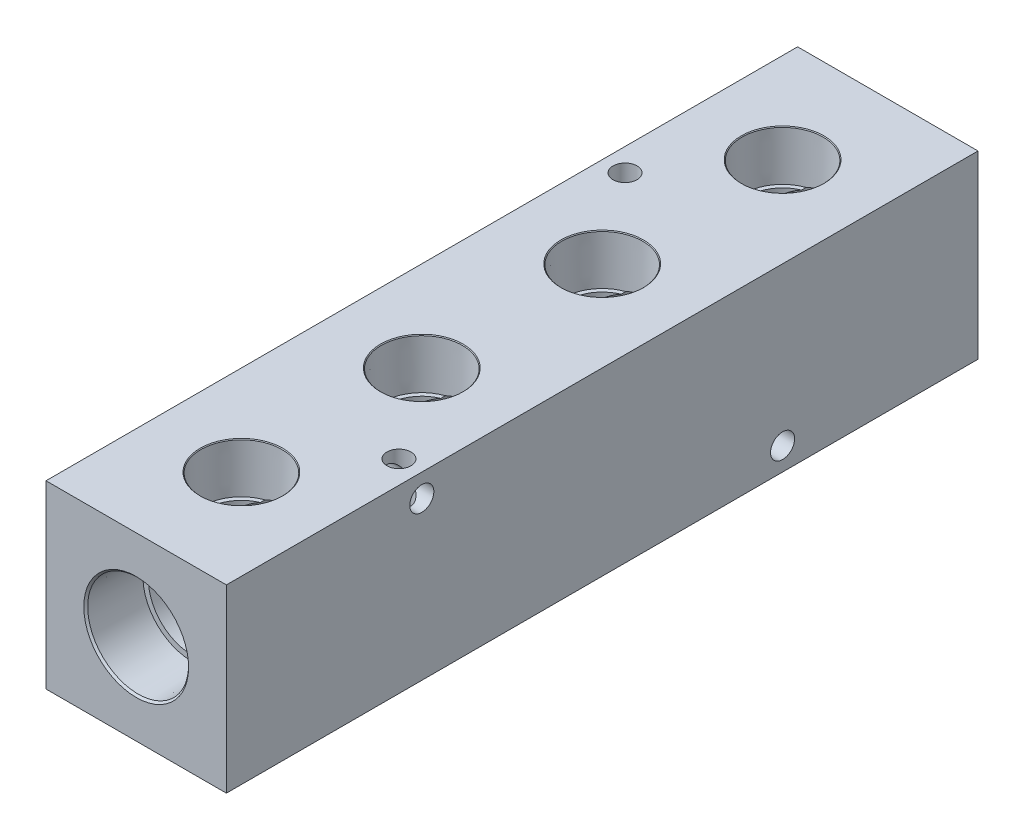
from build123d import *

# Parameters (mm, degrees)
SKETCH1_W                    = 38.1
SKETCH1_H                    = 38.1
BOSS_EXTRUDE1_DEPTH          = 79.375
SKETCH3_R                    = 8.5725
CUT_EXTRUDE1_DEPTH           = 10.35812
CUT_EXTRUDE1_DRAFT           = -1.783333333
LPATTERN1_COUNT              = 4
LPATTERN1_PITCH              = 38.1
LPATTERN1_COPY_1_SKETCH_R    = 8.5725
LPATTERN1_COPY_1_DEPTH       = 10.35812
LPATTERN1_COPY_1_DRAFT       = -1.783333333
LPATTERN1_COPY_2_SKETCH_R    = 8.5725
LPATTERN1_COPY_2_DEPTH       = 10.35812
LPATTERN1_COPY_2_DRAFT       = -1.783333333
LPATTERN1_COPY_3_SKETCH_R    = 8.5725
LPATTERN1_COPY_3_DEPTH       = 10.35812
LPATTERN1_COPY_3_DRAFT       = -1.783333333
SKETCH8_R                    = 10.668
CUT_EXTRUDE3_DEPTH           = 11.721742741
CUT_EXTRUDE3_DRAFT           = -1.783333333
SKETCH13_R                   = 11.064875
CUT_EXTRUDE6_DEPTH           = 2.54
CUT_EXTRUDE6_TAPER           = 45
CUT_EXTRUDE6_OTHER_WAY_DEPTH = 10.16
CUT_EXTRUDE6_OTHER_WAY_TAPER = 45
CIRPATTERN2_COUNT            = 2
CIRPATTERN2_COPY_1_SKETCH_R  = 10.668
CIRPATTERN2_COPY_1_DEPTH     = 11.721742741
CIRPATTERN2_COPY_1_DRAFT     = -1.783333333
SKETCH12_R                   = 2.54
CUT_EXTRUDE5_DEPTH           = 91.082757178
CIRPATTERN3_COUNT            = 2
CIRPATTERN3_ANGLE            = 90


# Read off the part's stored shape, not the designer's step: Cut-Extrude2
with BuildPart() as part:
    # Sketch1 → Boss-Extrude1 (new, symmetric)
    with BuildSketch(Plane.XY):
        Rectangle(SKETCH1_W, SKETCH1_H)
    extrude(amount=BOSS_EXTRUDE1_DEPTH, both=True)

    # Sketch2 → Cut-Revolve1 (revolve, cut)
    with BuildSketch(Plane(origin=(0, 0, 0), x_dir=(0, 0, -1), z_dir=(1, 0, 0)), mode=Mode.PRIVATE) as cut_revolve1_sk:
        Polygon((57.15, 19.05), (57.15, -4.411631326), (64.4921875, 0), (64.4921875, 19.05), align=None)
    cut_revolve1 = revolve(cut_revolve1_sk.sketch.rotate(Axis((0, 26.3921875, -57.15), (0, -1, 0)), 180), axis=Axis((0, 26.3921875, -57.15), (0, -1, 0)), mode=Mode.SUBTRACT)


with BuildPart() as cut_extrude1_tool:
    # Sketch3 → Cut-Extrude1 (with draft: the straight prism first)
    with BuildSketch(Plane(origin=(0, 19.05, 0), x_dir=(1, 0, 0), z_dir=(0, 1, 0))):
        with Locations((0, 57.15)):
            Circle(SKETCH3_R)
    extrude(amount=-CUT_EXTRUDE1_DEPTH)
    # Cut-Extrude1: the draft: its side faces are tilted about the plane it starts from
    cut_extrude1_sides = [cut_extrude1_tool.faces().sort_by_distance(p)[0] for p in [
        (-8.5725, 13.87094, -57.15),
    ]]
    draft(cut_extrude1_sides, Plane(origin=(0, 19.05, 0), x_dir=(1, 0, 0), z_dir=(0, 1, 0)), CUT_EXTRUDE1_DRAFT)


with BuildPart() as part_1:
    add(part.part)

    # Cut-Extrude1: cut by cut_extrude1_tool
    add(cut_extrude1_tool.part, mode=Mode.SUBTRACT)

    # Cut-Extrude2 outline → Cut-Extrude2 (revolve, cut)
    with BuildSketch(Plane.XY.offset(-57.15)):
        Polygon((8.567591048, 19.05), (8.567591048, 18.892333789), (8.725257259, 19.05), align=None)
    cut_extrude2 = revolve(axis=Axis((0, 0, -57.15), (0, 1, 0)), mode=Mode.SUBTRACT)

    # LPattern1: Cut-Revolve1, Cut-Extrude2 ×4
    with Locations(*[(0, 0, i * LPATTERN1_PITCH) for i in range(1, LPATTERN1_COUNT)]):
        add(cut_revolve1, mode=Mode.SUBTRACT)
        add(cut_extrude2, mode=Mode.SUBTRACT)


with BuildPart() as lpattern1_copy_1_tool:
    # LPattern1 copy 1 sketch → LPattern1 copy 1 (with draft: the straight prism first)
    with BuildSketch(Plane(origin=(0, 19.05, 38.1), x_dir=(1, 0, 0), z_dir=(0, 1, 0))):
        with Locations((0, 57.15)):
            Circle(LPATTERN1_COPY_1_SKETCH_R)
    extrude(amount=-LPATTERN1_COPY_1_DEPTH)
    # LPattern1 copy 1: the draft: its side faces are tilted about the plane it starts from
    lpattern1_copy_1_sides = [lpattern1_copy_1_tool.faces().sort_by_distance(p)[0] for p in [
        (-8.5725, 13.87094, -19.05),
    ]]
    draft(lpattern1_copy_1_sides, Plane(origin=(0, 19.05, 38.1), x_dir=(1, 0, 0), z_dir=(0, 1, 0)), LPATTERN1_COPY_1_DRAFT)


with BuildPart() as part_2:
    add(part_1.part)

    # LPattern1 copy 1: cut by lpattern1_copy_1_tool
    add(lpattern1_copy_1_tool.part, mode=Mode.SUBTRACT)


with BuildPart() as lpattern1_copy_2_tool:
    # LPattern1 copy 2 sketch → LPattern1 copy 2 (with draft: the straight prism first)
    with BuildSketch(Plane(origin=(0, 19.05, 76.2), x_dir=(1, 0, 0), z_dir=(0, 1, 0))):
        with Locations((0, 57.15)):
            Circle(LPATTERN1_COPY_2_SKETCH_R)
    extrude(amount=-LPATTERN1_COPY_2_DEPTH)
    # LPattern1 copy 2: the draft: its side faces are tilted about the plane it starts from
    lpattern1_copy_2_sides = [lpattern1_copy_2_tool.faces().sort_by_distance(p)[0] for p in [
        (-8.5725, 13.87094, 19.05),
    ]]
    draft(lpattern1_copy_2_sides, Plane(origin=(0, 19.05, 76.2), x_dir=(1, 0, 0), z_dir=(0, 1, 0)), LPATTERN1_COPY_2_DRAFT)


with BuildPart() as part_3:
    add(part_2.part)

    # LPattern1 copy 2: cut by lpattern1_copy_2_tool
    add(lpattern1_copy_2_tool.part, mode=Mode.SUBTRACT)


with BuildPart() as lpattern1_copy_3_tool:
    # LPattern1 copy 3 sketch → LPattern1 copy 3 (with draft: the straight prism first)
    with BuildSketch(Plane(origin=(0, 19.05, 114.3), x_dir=(1, 0, 0), z_dir=(0, 1, 0))):
        with Locations((0, 57.15)):
            Circle(LPATTERN1_COPY_3_SKETCH_R)
    extrude(amount=-LPATTERN1_COPY_3_DEPTH)
    # LPattern1 copy 3: the draft: its side faces are tilted about the plane it starts from
    lpattern1_copy_3_sides = [lpattern1_copy_3_tool.faces().sort_by_distance(p)[0] for p in [
        (-8.5725, 13.87094, 57.15),
    ]]
    draft(lpattern1_copy_3_sides, Plane(origin=(0, 19.05, 114.3), x_dir=(1, 0, 0), z_dir=(0, 1, 0)), LPATTERN1_COPY_3_DRAFT)


with BuildPart() as part_4:
    add(part_3.part)

    # LPattern1 copy 3: cut by lpattern1_copy_3_tool
    add(lpattern1_copy_3_tool.part, mode=Mode.SUBTRACT)

    # Sketch7 → Cut-Revolve2 (revolve, cut)
    with BuildSketch(Plane(origin=(0, 0, 0), x_dir=(0, 0, -1), z_dir=(1, 0, 0)), mode=Mode.PRIVATE) as cut_revolve2_sk:
        Polygon((-79.375, 0), (5.484730838, 0), (0, 9.128125), (-79.375, 9.128125), align=None)
    cut_revolve2 = revolve(cut_revolve2_sk.sketch.rotate(Axis((0, 0, 88.503125), (0, 0, -1)), 90), axis=Axis((0, 0, 88.503125), (0, 0, -1)), mode=Mode.SUBTRACT)


with BuildPart() as cut_extrude3_tool:
    # Sketch8 → Cut-Extrude3 (with draft: the straight prism first)
    with BuildSketch(Plane.XY.offset(79.375)):
        Circle(SKETCH8_R)
    extrude(amount=-CUT_EXTRUDE3_DEPTH)
    # Cut-Extrude3: the draft: its side faces are tilted about the plane it starts from
    cut_extrude3_sides = [cut_extrude3_tool.faces().sort_by_distance(p)[0] for p in [
        (-10.668, 0, 73.514128629),
    ]]
    draft(cut_extrude3_sides, Plane.XY.offset(79.375), CUT_EXTRUDE3_DRAFT)


with BuildPart() as part_5:
    add(part_4.part)

    # Cut-Extrude3: cut by cut_extrude3_tool
    add(cut_extrude3_tool.part, mode=Mode.SUBTRACT)

    # Sketch13 → Cut-Extrude6 (cut)
    with BuildSketch(Plane.XY.offset(79.375)):
        Circle(SKETCH13_R)
    cut_extrude6 = extrude(amount=-CUT_EXTRUDE6_DEPTH, taper=CUT_EXTRUDE6_TAPER, mode=Mode.SUBTRACT)

    # Sketch13 → Cut-Extrude6 other way (cut)
    with BuildSketch(Plane.XY.offset(79.375)):
        Circle(SKETCH13_R)
    extrude(amount=CUT_EXTRUDE6_OTHER_WAY_DEPTH, taper=CUT_EXTRUDE6_OTHER_WAY_TAPER, mode=Mode.SUBTRACT)

    # CirPattern2: Cut-Revolve2, Cut-Extrude6 ×2 about axis
    cirpattern2_axis = Axis((0, 21.367211937, 0), (0, -1, 0))
    add([cut_revolve2.rotate(cirpattern2_axis, i * 360 / CIRPATTERN2_COUNT) for i in range(1, CIRPATTERN2_COUNT)], mode=Mode.SUBTRACT)
    add([cut_extrude6.rotate(cirpattern2_axis, i * 360 / CIRPATTERN2_COUNT) for i in range(1, CIRPATTERN2_COUNT)], mode=Mode.SUBTRACT)


with BuildPart() as cirpattern2_copy_1_tool:
    # CirPattern2 copy 1 sketch → CirPattern2 copy 1 (with draft: the straight prism first)
    with BuildSketch(Plane(origin=(0, 0, -79.375), x_dir=(-1, 0, 0), z_dir=(0, 0, -1))):
        Circle(CIRPATTERN2_COPY_1_SKETCH_R)
    extrude(amount=-CIRPATTERN2_COPY_1_DEPTH)
    # CirPattern2 copy 1: the draft: its side faces are tilted about the plane it starts from
    cirpattern2_copy_1_sides = [cirpattern2_copy_1_tool.faces().sort_by_distance(p)[0] for p in [
        (10.668, 0, -73.514128629),
    ]]
    draft(cirpattern2_copy_1_sides, Plane(origin=(0, 0, -79.375), x_dir=(-1, 0, 0), z_dir=(0, 0, -1)), CIRPATTERN2_COPY_1_DRAFT)


with BuildPart() as part_6:
    add(part_5.part)

    # CirPattern2 copy 1: cut by cirpattern2_copy_1_tool
    add(cirpattern2_copy_1_tool.part, mode=Mode.SUBTRACT)

    # Sketch12 → Cut-Extrude5 (cut, through all)
    with BuildSketch(Plane(origin=(0, 19.05, 0), x_dir=(1, 0, 0), z_dir=(0, 1, 0))):
        with Locations(Location((-14.224, 38.1, 0), (0, 0, 270))):
            Circle(SKETCH12_R)
        with Locations(Location((14.224, -38.1, 0), (0, 0, 270))):
            Circle(SKETCH12_R)
    cut_extrude5 = extrude(amount=-CUT_EXTRUDE5_DEPTH, mode=Mode.SUBTRACT)

    # CirPattern3: Cut-Extrude5 ×2 about axis
    cirpattern3_axis = Axis((0, 0, 87.593551009), (0, 0, 1))
    for i in range(1, CIRPATTERN3_COUNT):
        add(cut_extrude5.rotate(cirpattern3_axis, i * CIRPATTERN3_ANGLE / (CIRPATTERN3_COUNT - 1)), mode=Mode.SUBTRACT)


solid = part_6.part
